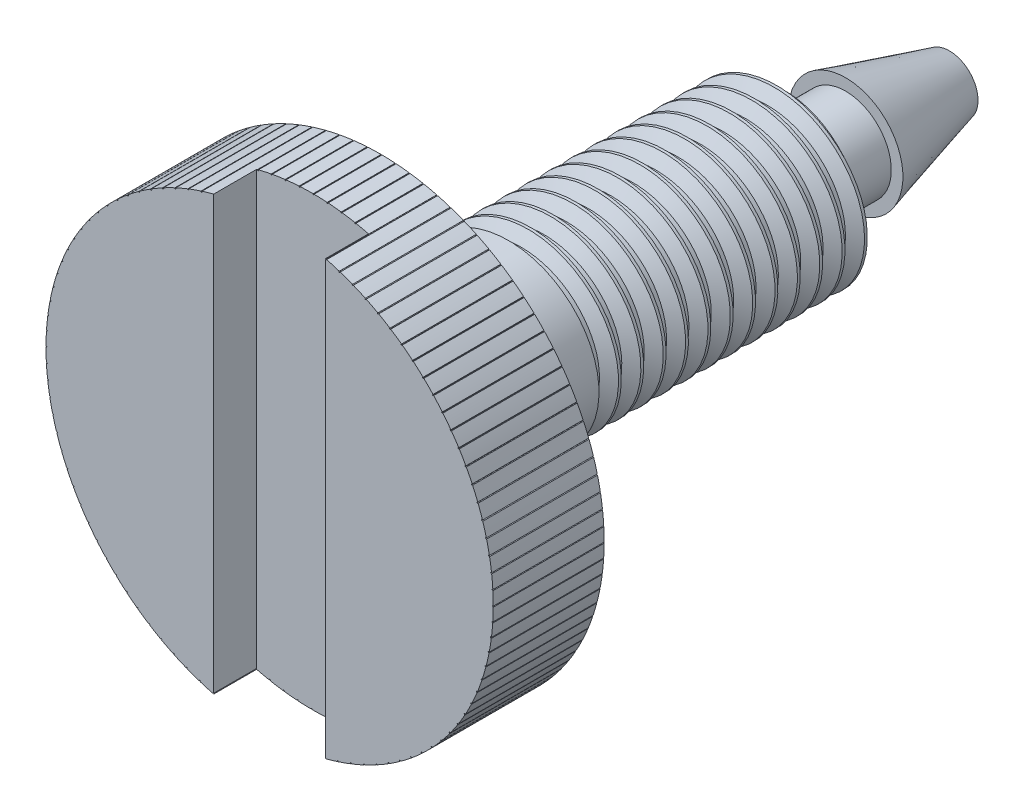
from build123d import *

# Parameters (mm, degrees)
SKETCH2_W          = 1.5875
SKETCH2_H          = 1.2192
CUT_EXTRUDE1_DEPTH = 6.35
THREAD1_PITCH      = 0.3175
SKETCH9_W          = 0.015779071
SKETCH9_H          = 0.01208002
CUT_EXTRUDE4_DEPTH = 10.241342426
CIRPATTERN1_COUNT  = 100


with BuildPart() as part:
    # Sketch1 → Revolve1 (revolve)
    with BuildSketch(Plane(origin=(0, 0, 0), x_dir=(1, 0, 0), z_dir=(0, 1, 0)), mode=Mode.PRIVATE) as revolve1_sk:
        Polygon((0, 0), (3.175, 0), (3.175, 1.5748), (1.2573, 1.5748), (1.2573, 7.3152), (0.6477, 7.3152), (0.6477, 8.1788), (0.8128, 8.1788), (0.4064, 9.652), (0, 9.652), align=None)
    revolve(revolve1_sk.sketch.rotate(Axis((0, 0, -9.652), (0, 0, 1)), 180), axis=Axis((0, 0, -9.652), (0, 0, 1)))

    # Sketch2 → Cut-Extrude1 (cut, symmetric)
    with BuildSketch(Plane(origin=(0, 0, 0), x_dir=(1, 0, 0), z_dir=(0, 1, 0))):
        Rectangle(SKETCH2_W, SKETCH2_H)
    extrude(amount=CUT_EXTRUDE1_DEPTH, both=True, mode=Mode.SUBTRACT)

    # Thread1: the profile of Thread Profile1 profile screwed along a right-hand helix of 13.6 turns, 6 arcs to a turn; built about Z, then put on its axis
    thread1_z = Axis((0, 0, 0), (0, 0, 1))
    thread1_corners = [(1.2576, 0, -0.000173205), (1.2576, 0, 0.277985704), (1.085448085, 0, 0.17859375), (1.085448085, 0, 0.09921875)]
    with BuildLine(mode=Mode.PRIVATE) as thread1_profile:
        Line(thread1_corners[0], thread1_corners[1])
        Line(thread1_corners[1], thread1_corners[2])
        Line(thread1_corners[2], thread1_corners[3])
        Line(thread1_corners[3], thread1_corners[0])
    thread1_cap = Face(thread1_profile.wire())
    thread1_turn_angles = [0, 30, 60, 90, 120, 150, 180, 210, 240, 270, 300, 330, 360]
    thread1_turn_weights = [1, 0.8660254037844387, 1, 0.8660254037844387, 1, 0.8660254037844387, 1, 0.8660254037844387, 1, 0.8660254037844387, 1, 0.8660254037844387, 1]
    thread1_turn_rails = [Edge.make_bspline([Vector(p[0], p[1], 0).rotate(thread1_z, thread1_turn_angles[k]) / thread1_turn_weights[k] + Vector(0, 0, p[2] + THREAD1_PITCH * thread1_turn_angles[k] / 360) for k in range(13)], [0, 0, 0, 1, 1, 2, 2, 3, 3, 4, 4, 5, 5, 6, 6, 6], 2, thread1_turn_weights) for p in thread1_corners]
    thread1_turn_sides = [Face.make_surface_from_curves(thread1_turn_rails[p[0]], thread1_turn_rails[p[1]]) for p in [(0, 1), (1, 2), (2, 3), (3, 0)]]
    thread1_last_angles = [4680, 4710, 4740, 4770, 4800, 4830, 4860, 4878, 4896]
    thread1_last_weights = [1, 0.8660254037844387, 1, 0.8660254037844387, 1, 0.8660254037844387, 1, 0.951056516295156, 1]
    thread1_last_rails = [Edge.make_bspline([Vector(p[0], p[1], 0).rotate(thread1_z, thread1_last_angles[k]) / thread1_last_weights[k] + Vector(0, 0, p[2] + THREAD1_PITCH * thread1_last_angles[k] / 360) for k in range(9)], [0, 0, 0, 1, 1, 2, 2, 3, 3, 4, 4, 4], 2, thread1_last_weights) for p in thread1_corners]
    thread1_last_sides = [Face.make_surface_from_curves(thread1_last_rails[p[0]], thread1_last_rails[p[1]]) for p in [(0, 1), (1, 2), (2, 3), (3, 0)]]
    thread1 = Plane(origin=(0, 0, -7.8232), x_dir=(1, 0, 0), z_dir=(0, 0, 1)) * Solid(Shell([*[p.moved(Location((0, 0, THREAD1_PITCH * i))) for i in range(13) for p in thread1_turn_sides], *thread1_last_sides, thread1_cap, thread1_cap.rotate(thread1_z, 4896).moved(Location((0, 0, THREAD1_PITCH * 4896 / 360)))]))
    add(thread1, mode=Mode.SUBTRACT)

    # Sketch9 → Cut-Extrude4 (cut, through all)
    with BuildSketch(Plane(origin=(0, 0, -1.5748), x_dir=(-1, 0, 0), z_dir=(0, 0, -1))):
        with Locations((-2.95249304, 1.155110355)):
            Rectangle(SKETCH9_W, SKETCH9_H)
    cut_extrude4 = extrude(amount=-CUT_EXTRUDE4_DEPTH, mode=Mode.SUBTRACT)

    # CirPattern1: Cut-Extrude4 ×100 about axis
    cirpattern1_axis = Axis((0, 0, 0), (0, 0, 1))
    for i in range(1, CIRPATTERN1_COUNT):
        add(cut_extrude4.rotate(cirpattern1_axis, i * 360 / CIRPATTERN1_COUNT), mode=Mode.SUBTRACT)


solid = part.part
